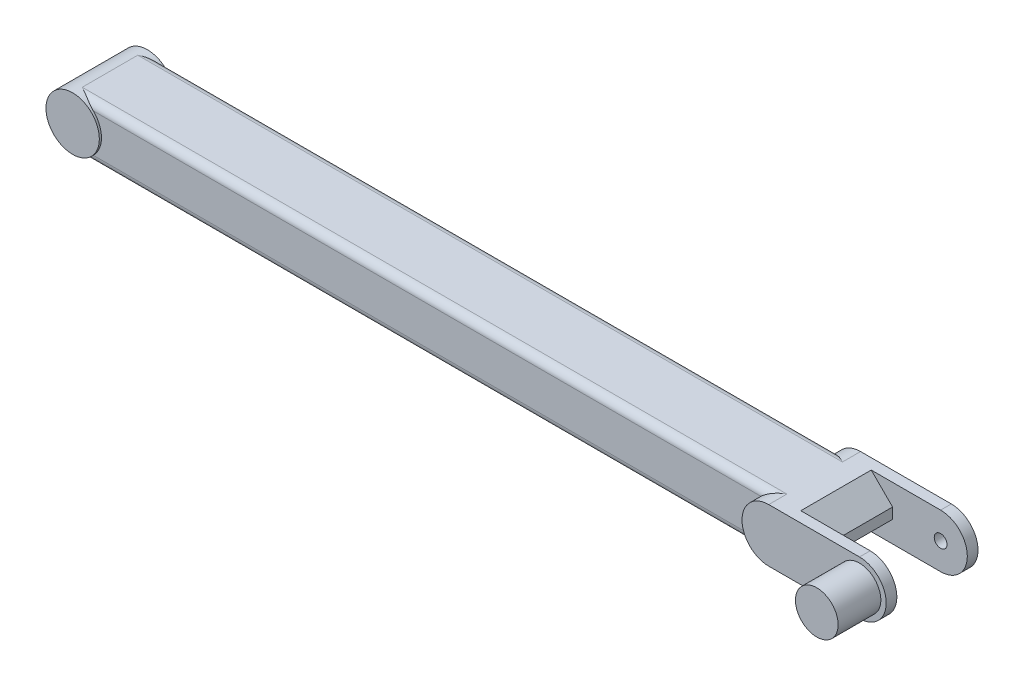
from build123d import *

# Parameters (mm, degrees)
AUFSATZ_LINEAR_AUSTRAGEN1_DEPTH      = 35
AUFSATZ_LINEAR_AUSTRAGEN1_DEPTH_BACK = 35
SKIZZE1_R                            = 25
SKIZZE2_W                            = 66
SKIZZE2_H                            = 50
AUFSATZ_LINEAR_AUSTRAGEN2_DEPTH      = 700
AUFSATZ_LINEAR_AUSTRAGEN3_DEPTH      = 10
SCHNITT_LINEAR_AUSTRAGEN1_REACH      = 776.344
SKIZZE4_R                            = 6
VERRUNDUNG2_START                    = -1e-07
VERRUNDUNG2_DEPTH                    = 660.0000001
VERRUNDUNG2_START_2                  = -33
VERRUNDUNG2_2_DEPTH                  = 66
FASE1_SIZE                           = 20
SKIZZE5_R                            = 20
AUFSATZ_LINEAR_AUSTRAGEN4_DEPTH      = 40


with BuildPart() as part:
    # Skizze1 → Aufsatz-Linear austragen1 (new, two sides: drawn at the far end of the back side and taken through both)
    with BuildSketch(Plane.XY.offset(-AUFSATZ_LINEAR_AUSTRAGEN1_DEPTH_BACK)):
        Circle(SKIZZE1_R)
    extrude(amount=AUFSATZ_LINEAR_AUSTRAGEN1_DEPTH + AUFSATZ_LINEAR_AUSTRAGEN1_DEPTH_BACK)

    # Skizze2 → Aufsatz-Linear austragen2 (add)
    with BuildSketch(Plane(origin=(0, 0, 0), x_dir=(0, 0, -1), z_dir=(1, 0, 0))):
        Rectangle(SKIZZE2_W, SKIZZE2_H)
    extrude(amount=AUFSATZ_LINEAR_AUSTRAGEN2_DEPTH)

    # Skizze3 → Aufsatz-Linear austragen3 (add)
    with BuildSketch(Plane(origin=(0, 0, -33), x_dir=(-1, 0, 0), z_dir=(0, 0, -1))):
        with BuildLine():
            Line((-700, 25), (-660, 25))
            ThreePointArc((-660, 25), (-635, 0), (-660, -25))
            Line((-660, -25), (-700, -25))
            Line((-700, -25), (-745, -25))
            ThreePointArc((-745, -25), (-770, 0), (-745, 25))
            Line((-745, 25), (-700, 25))
        make_face()
    aufsatz_linear_austragen3 = extrude(amount=AUFSATZ_LINEAR_AUSTRAGEN3_DEPTH)

    # Skizze4 → Schnitt-Linear austragen1 (cut, up to next)
    with BuildSketch(Plane(origin=(0, 0, -43), x_dir=(-1, 0, 0), z_dir=(0, 0, -1)), mode=Mode.PRIVATE) as schnitt_linear_austragen1_sk1:
        with Locations((-745, 0)):
            Circle(SKIZZE4_R)
    schnitt_linear_austragen1_tool1 = extrude(schnitt_linear_austragen1_sk1.sketch, amount=-SCHNITT_LINEAR_AUSTRAGEN1_REACH, mode=Mode.PRIVATE) & part.part
    schnitt_linear_austragen1 = schnitt_linear_austragen1_tool1.solids().sort_by_distance((745, 0, -43))[0]
    add(schnitt_linear_austragen1, mode=Mode.SUBTRACT)

    # Spiegeln1: Aufsatz-Linear austragen3, Schnitt-Linear austragen1 across plane
    add(aufsatz_linear_austragen3.mirror(Plane.XY))
    add(schnitt_linear_austragen1.mirror(Plane.XY), mode=Mode.SUBTRACT)

    # Verrundung2: read off the stored shape, not the designer's step
    # Verrundung2 outline → Verrundung2 (cut)
    with BuildSketch(Plane.YZ.offset(VERRUNDUNG2_START)):
        with BuildLine():
            Line((-25, -33), (-18, -33))
            ThreePointArc((-18, -33), (-22.949747468, -30.949747468), (-25, -26))
            Line((-25, -26), (-25, -33))
        make_face()
        with BuildLine():
            ThreePointArc((25, -26), (22.949747468, -30.949747468), (18, -33))
            Line((18, -33), (25, -33))
            Line((25, -33), (25, -26))
        make_face()
        with BuildLine():
            Line((-25, 33), (-25, 26))
            ThreePointArc((-25, 26), (-22.949747468, 30.949747468), (-18, 33))
            Line((-18, 33), (-25, 33))
        make_face()
        with BuildLine():
            ThreePointArc((18, 33), (22.949747468, 30.949747468), (25, 26))
            Line((25, 26), (25, 33))
            Line((25, 33), (18, 33))
        make_face()
    extrude(amount=VERRUNDUNG2_DEPTH, mode=Mode.SUBTRACT)

    # Verrundung2 2 outline → Verrundung2 2 (add)
    with BuildSketch(Plane.XY.offset(VERRUNDUNG2_START_2)):
        with BuildLine():
            Line((17.349351573, -18), (-1e-07, -18))
            Line((-1e-07, -18), (0, -25))
            ThreePointArc((0, -25), (9.354143467, -23.184046239), (17.349351573, -18))
        make_face()
        with BuildLine():
            Line((660, -18), (642.650648427, -18))
            ThreePointArc((642.650648427, -18), (650.645856533, -23.184046239), (660, -25))
            Line((660, -25), (660, -18))
        make_face()
        with BuildLine():
            Line((660, 18), (660, 25))
            ThreePointArc((660, 25), (650.645856533, 23.184046239), (642.650648427, 18))
            Line((642.650648427, 18), (660, 18))
        make_face()
        with BuildLine():
            ThreePointArc((17.349351573, 18), (9.354143467, 23.184046239), (0, 25))
            Line((0, 25), (-1e-07, 18))
            Line((-1e-07, 18), (17.349351573, 18))
        make_face()
    extrude(amount=VERRUNDUNG2_2_DEPTH)

    # Fase1
    fase1_edges = [part.edges().sort_by_distance(p)[0] for p in [
        (700, -25, 0),
        (700, 25, 0),
    ]]
    chamfer(fase1_edges, length=FASE1_SIZE)

    # Skizze5 → Aufsatz-Linear austragen4 (add)
    with BuildSketch(Plane.XY.offset(43)):
        with Locations(Location((745, 0, 0), (0, 0, 180))):
            Circle(SKIZZE5_R)
    extrude(amount=AUFSATZ_LINEAR_AUSTRAGEN4_DEPTH)


solid = part.part
